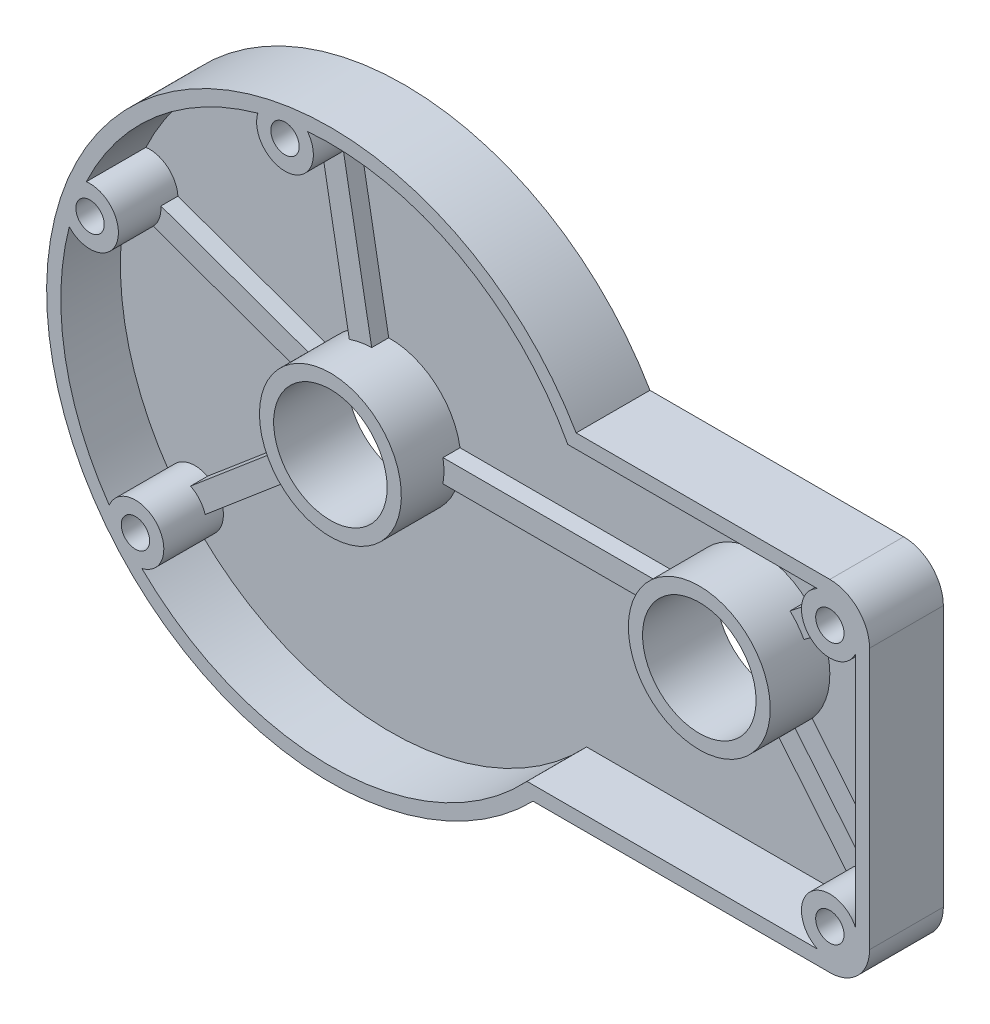
from build123d import *

# Parameters (mm, degrees)
SKETCH1_R        = 10
SKETCH1_R_2      = 2.5
EXTRUDE1_DEPTH   = 13
SHELL1_START     = -10.5
SHELL1_OUTLINE_R = 12.5
SHELL1_DEPTH     = 10.5
RIB1_REACH       = 109.616
SKETCH2_WALLS_W  = 262.2324325
SKETCH2_WALLS_H  = 4


# Read off the part's stored shape, not the designer's step: Shell1
with BuildPart() as part:
    # Sketch1 → Extrude1 (new body)
    with BuildSketch(Plane.XY):
        with BuildLine():
            Line((43.301270189, 25), (88, 25))
            ThreePointArc((88, 25), (92.949747468, 22.949747468), (95, 18))
            Line((95, 18), (95, -28))
            ThreePointArc((95, -28), (92.949747468, -32.949747468), (88, -35))
            Line((88, -35), (35.707142143, -35))
            ThreePointArc((35.707142143, -35), (-49.604256922, 6.278351312), (43.301270189, 25))
        make_face()
        Circle(SKETCH1_R, mode=Mode.SUBTRACT)
        with Locations((65, 0)):
            Circle(SKETCH1_R, mode=Mode.SUBTRACT)
        with Locations((-8, 44.283179651)):
            Circle(SKETCH1_R_2, mode=Mode.SUBTRACT)
        with Locations((-42.350358538, 15.213386595)):
            Circle(SKETCH1_R_2, mode=Mode.SUBTRACT)
        with Locations((-34.350358538, -29.069793056)):
            Circle(SKETCH1_R_2, mode=Mode.SUBTRACT)
        with Locations((88, 18)):
            Circle(SKETCH1_R_2, mode=Mode.SUBTRACT)
        with Locations((88, -28)):
            Circle(SKETCH1_R_2, mode=Mode.SUBTRACT)
    extrude(amount=-EXTRUDE1_DEPTH)

    # Shell1 outline → Shell1 (cut)
    with BuildSketch(Plane.XY.offset(SHELL1_START)):
        with BuildLine():
            ThreePointArc((-43.004716488, 20.170383234), (-37.644763145, 13.523010307), (-46.009463032, 11.805901554))
            ThreePointArc((-46.009463032, 11.805901554), (-46.743356298, -8.444444445), (-38.970422528, -27.157985344))
            ThreePointArc((-38.970422528, -27.157985344), (-30.533652034, -25.83981605), (-33.228942177, -33.942413023))
            ThreePointArc((-33.228942177, -33.942413023), (1.009270558, -47.489276399), (34.641016151, -32.5))
            Line((34.641016151, -32.5), (85.820550528, -32.5))
            ThreePointArc((85.820550528, -32.5), (84.464466094, -24.464466094), (92.5, -25.820550528))
            Line((92.5, -25.820550528), (92.5, 15.820550528))
            ThreePointArc((92.5, 15.820550528), (84.464466094, 14.464466094), (85.820550528, 22.5))
            Line((85.820550528, 22.5), (41.833001327, 22.5))
            ThreePointArc((41.833001327, 22.5), (22.611889377, 41.772628105), (-4.03429396, 47.328368578))
            ThreePointArc((-4.03429396, 47.328368578), (-7.111111111, 39.362826356), (-12.780520855, 45.748314577))
            ThreePointArc((-12.780520855, 45.748314577), (-30.684781559, 36.25871179), (-43.004716488, 20.170383234))
        make_face()
        Circle(SHELL1_OUTLINE_R, mode=Mode.SUBTRACT)
        with Locations((65, 0)):
            Circle(SHELL1_OUTLINE_R, mode=Mode.SUBTRACT)
    extrude(amount=SHELL1_DEPTH, mode=Mode.SUBTRACT)

    # Sketch2 walls → Rib1 (add, up to next)
    with BuildSketch(Plane.XY.offset(-7.5), mode=Mode.PRIVATE) as rib1_sk1:
        Polygon((-29.277690873, 150.813655589), (15.56363046, -97.40088046), (19.499913096, -96.689769349), (-25.341408238, 151.5247667), align=None)
    rib1_tool1 = extrude(rib1_sk1.sketch, amount=-RIB1_REACH, mode=Mode.PRIVATE) - part.part
    # Sketch2 walls → Rib1 (add, up to next)
    with BuildSketch(Plane.XY.offset(-7.5), mode=Mode.PRIVATE) as rib1_sk2:
        Polygon((93.48575309, -31.457464562), (-143.895001384, 53.816080049), (-145.247302414, 50.051603734), (92.133452059, -35.221940877), align=None)
    rib1_tool2 = extrude(rib1_sk2.sketch, amount=-RIB1_REACH, mode=Mode.PRIVATE) - part.part
    # Sketch2 walls → Rib1 (add, up to next)
    with BuildSketch(Plane.XY.offset(-7.5), mode=Mode.PRIVATE) as rib1_sk3:
        Polygon((-115.969611541, -100.762051855), (76.569821599, 62.178939584), (73.985839994, 65.232304787), (-118.553593146, -97.708686652), align=None)
    rib1_tool3 = extrude(rib1_sk3.sketch, amount=-RIB1_REACH, mode=Mode.PRIVATE) - part.part
    # Sketch2 walls → Rib1 (add, up to next)
    with BuildSketch(Plane.XY.offset(-7.5), mode=Mode.PRIVATE) as rib1_sk4:
        with Locations((32.5, 0)):
            Rectangle(SKETCH2_WALLS_W, SKETCH2_WALLS_H)
    rib1_tool4 = extrude(rib1_sk4.sketch, amount=-RIB1_REACH, mode=Mode.PRIVATE) - part.part
    # Sketch2 walls → Rib1 (add, up to next)
    with BuildSketch(Plane.XY.offset(-7.5), mode=Mode.PRIVATE) as rib1_sk5:
        Polygon((-11.428146954, -62.35299881), (174.768430011, 83.366061423), (172.303196964, 86.516081427), (-13.893380001, -59.202978806), align=None)
    rib1_tool5 = extrude(rib1_sk5.sketch, amount=-RIB1_REACH, mode=Mode.PRIVATE) - part.part
    # Sketch2 walls → Rib1 (add, up to next)
    with BuildSketch(Plane.XY.offset(-7.5), mode=Mode.PRIVATE) as rib1_sk6:
        Polygon((0.858947254, 74.933860572), (155.397541961, -113.20008081), (158.488446979, -110.661123117), (3.949852272, 77.472818265), align=None)
    rib1_tool6 = extrude(rib1_sk6.sketch, amount=-RIB1_REACH, mode=Mode.PRIVATE) - part.part
    add(rib1_tool1.solids().sort_by_distance((-4.888888889, 27.06194312, -7.5))[0])
    add(rib1_tool2.solids().sort_by_distance((-25.880774662, 9.297069586, -7.5))[0])
    add(rib1_tool3.solids().sort_by_distance((-20.991885773, -17.764873534, -7.5))[0])
    add(rib1_tool4.solids().sort_by_distance((32.5, 0, -7.5))[0])
    add(rib1_tool5.solids().sort_by_distance((80.437525005, 12.081541308, -7.5))[0])
    add(rib1_tool6.solids().sort_by_distance((79.673697117, -17.863631273, -7.5))[0])


solid = part.part
